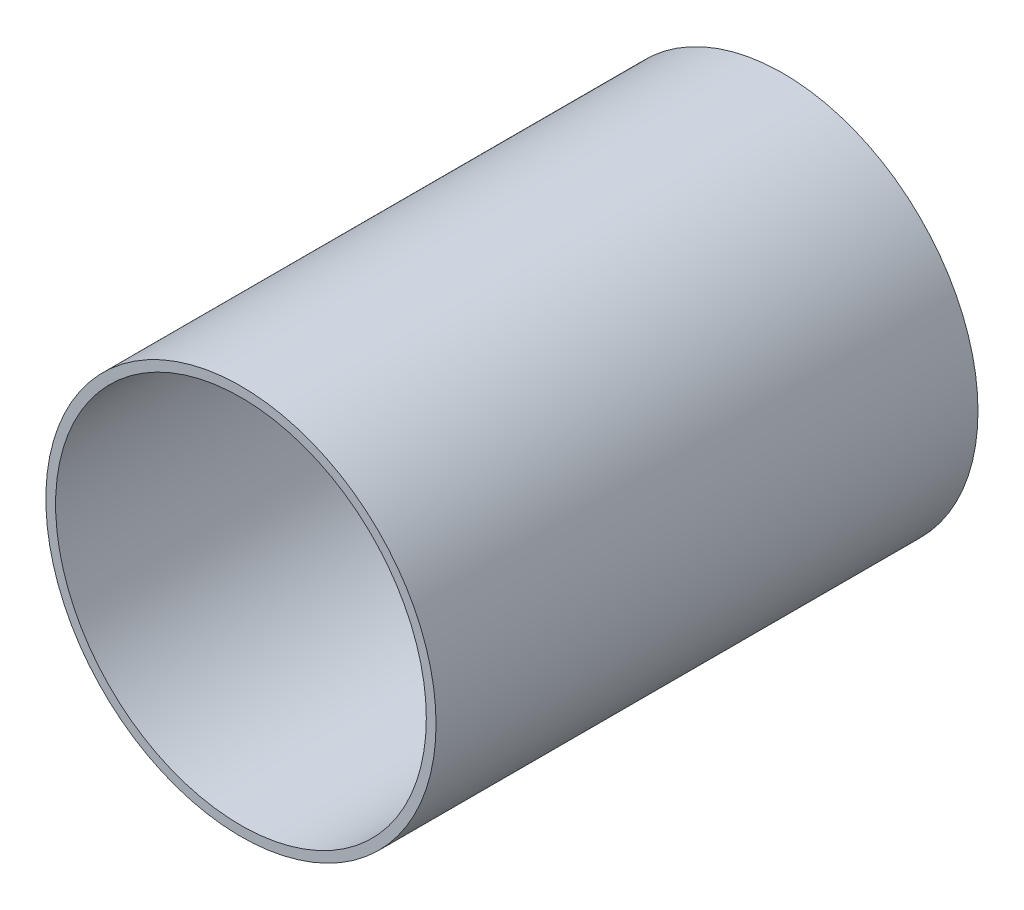
from build123d import *

# Parameters (mm, degrees)
SKETCH1_R           = 54
SKETCH1_R_2         = 51.304
BOSS_EXTRUDE1_DEPTH = 150
CIRPATTERN1_COUNT   = 4


with BuildPart() as part:
    # Sketch1 → Boss-Extrude1 (new body)
    with BuildSketch(Plane(origin=(0, 0, 0), x_dir=(0, 1, 0), z_dir=(0, 0, 1))):
        Circle(SKETCH1_R)
        Circle(SKETCH1_R_2, mode=Mode.SUBTRACT)
    extrude(amount=BOSS_EXTRUDE1_DEPTH)

    # CirPattern1: part ×4 about axis
    cirpattern1_axis = Axis((0, 0, -7.50011), (0, 0, 1))


with BuildPart() as part_1:
    add(part.part)
    for i in range(1, CIRPATTERN1_COUNT):
        add(part.part.rotate(cirpattern1_axis, i * 360 / CIRPATTERN1_COUNT))


solid = part_1.part
